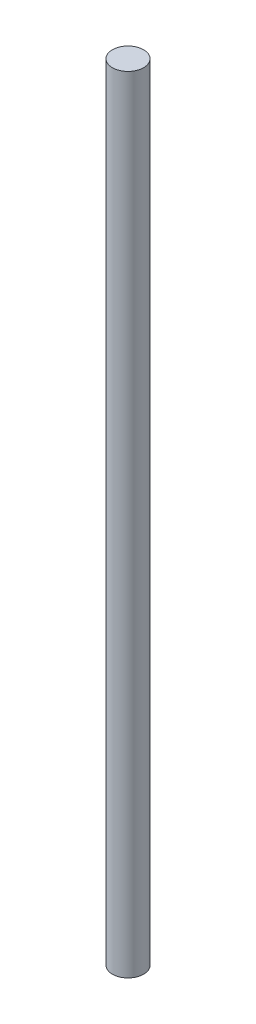
from build123d import *

# Parameters (mm, degrees)
SKETCH1_R           = 4
BOSS_EXTRUDE1_DEPTH = 100.7125


with BuildPart() as part:
    # Sketch1 → Boss-Extrude1 (new, symmetric)
    with BuildSketch(Plane(origin=(0, 0, 0), x_dir=(1, 0, 0), z_dir=(0, 1, 0))):
        Circle(SKETCH1_R)
    extrude(amount=BOSS_EXTRUDE1_DEPTH, both=True)


solid = part.part
